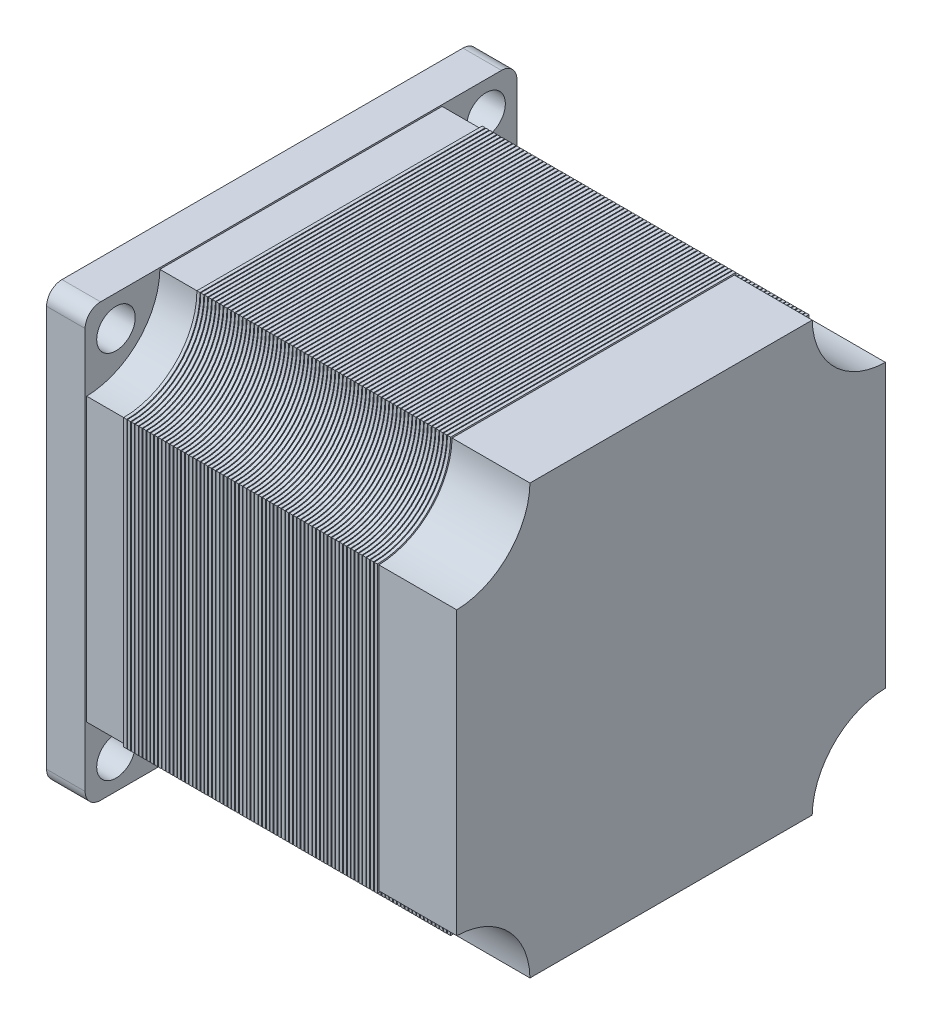
from build123d import *
from build123d.topology import SkipClean

# Parameters (mm, degrees)
SKETCH1_R           = 3
BOSS_EXTRUDE1_DEPTH = 33
CUT_EXTRUDE4_START  = -0.1
CUT_EXTRUDE4_DEPTH  = 0.1
LPATTERN5_COUNT     = 67
LPATTERN5_PITCH     = 0.5
BOSS_EXTRUDE4_DEPTH = 10
BOSS_EXTRUDE5_START = 5
BOSS_EXTRUDE5_DEPTH = 5
SKETCH14_R          = 2.5
BOSS_EXTRUDE7_DEPTH = 5
SKETCH15_R          = 20.5
BOSS_EXTRUDE8_DEPTH = 2
SKETCH16_R          = 3
CUT_EXTRUDE6_DEPTH  = 15


with BuildPart() as part:
    # Sketch1 → Boss-Extrude1 (new body)
    with BuildSketch(Plane(origin=(0, 0, 0), x_dir=(0, 0, -1), z_dir=(1, 0, 0))):
        with BuildLine():
            Line((-18.5, 28), (18.5, 28))
            ThreePointArc((18.5, 28), (21.282485579, 21.282485579), (28, 18.5))
            Line((28, 18.5), (28, -18.5))
            ThreePointArc((28, -18.5), (21.282485579, -21.282485579), (18.5, -28))
            Line((18.5, -28), (-18.5, -28))
            ThreePointArc((-18.5, -28), (-21.282485579, -21.282485579), (-28, -18.5))
            Line((-28, -18.5), (-28, 18.5))
            ThreePointArc((-28, 18.5), (-21.282485579, 21.282485579), (-18.5, 28))
        make_face()
        Circle(SKETCH1_R, mode=Mode.SUBTRACT)
    extrude(amount=BOSS_EXTRUDE1_DEPTH)

    # Sketch6 → Cut-Extrude4 (cut)
    with BuildSketch(Plane(origin=(33, 0, 0), x_dir=(0, 0, -1), z_dir=(1, 0, 0)).offset(CUT_EXTRUDE4_START)):
        with BuildLine():
            Line((28, -18.5), (28, 18.5))
            ThreePointArc((28, 18.5), (21.282485579, 21.282485579), (18.5, 28))
            Line((18.5, 28), (-18.5, 28))
            ThreePointArc((-18.5, 28), (-21.282485579, 21.282485579), (-28, 18.5))
            Line((-28, 18.5), (-28, -18.5))
            ThreePointArc((-28, -18.5), (-21.282485579, -21.282485579), (-18.5, -28))
            Line((-18.5, -28), (18.5, -28))
            ThreePointArc((18.5, -28), (21.282485579, -21.282485579), (28, -18.5))
        make_face()
        with BuildLine():
            Line((18.302062075, 27.8), (-18.302062075, 27.8))
            ThreePointArc((-18.302062075, 27.8), (-21.141064222, 21.141064222), (-27.8, 18.302062075))
            Line((-27.8, 18.302062075), (-27.8, -18.302062075))
            ThreePointArc((-27.8, -18.302062075), (-21.141064222, -21.141064222), (-18.302062075, -27.8))
            Line((-18.302062075, -27.8), (18.302062075, -27.8))
            ThreePointArc((18.302062075, -27.8), (21.141064222, -21.141064222), (27.8, -18.302062075))
            Line((27.8, -18.302062075), (27.8, 18.302062075))
            ThreePointArc((27.8, 18.302062075), (21.141064222, 21.141064222), (18.302062075, 27.8))
        make_face(mode=Mode.SUBTRACT)
    cut_extrude4 = extrude(amount=CUT_EXTRUDE4_DEPTH, mode=Mode.SUBTRACT)

    # LPattern5: Cut-Extrude4 ×67
    with Locations(*[(-i * LPATTERN5_PITCH, 0, 0) for i in range(1, LPATTERN5_COUNT)]):
        add(cut_extrude4, mode=Mode.SUBTRACT)

    # Sketch10 → Boss-Extrude4 (add)
    with BuildSketch(Plane(origin=(33, 0, 0), x_dir=(0, 0, -1), z_dir=(1, 0, 0))):
        with BuildLine():
            Line((27.8, -18.302062075), (27.8, 18.302062075))
            ThreePointArc((27.8, 18.302062075), (21.141064222, 21.141064222), (18.302062075, 27.8))
            Line((18.302062075, 27.8), (-18.302062075, 27.8))
            ThreePointArc((-18.302062075, 27.8), (-21.141064222, 21.141064222), (-27.8, 18.302062075))
            Line((-27.8, 18.302062075), (-27.8, -18.302062075))
            ThreePointArc((-27.8, -18.302062075), (-21.141064222, -21.141064222), (-18.302062075, -27.8))
            Line((-18.302062075, -27.8), (18.302062075, -27.8))
            ThreePointArc((18.302062075, -27.8), (21.141064222, -21.141064222), (27.8, -18.302062075))
        make_face()
    extrude(amount=BOSS_EXTRUDE4_DEPTH)

    # Sketch12 → Boss-Extrude5 (add)
    with BuildSketch(Plane.ZY.offset(BOSS_EXTRUDE5_START)):
        with BuildLine():
            Line((-27.8, 18.302062075), (-27.8, -18.302062075))
            ThreePointArc((-27.8, -18.302062075), (-21.141064222, -21.141064222), (-18.302062075, -27.8))
            Line((-18.302062075, -27.8), (18.302062075, -27.8))
            ThreePointArc((18.302062075, -27.8), (21.141064222, -21.141064222), (27.8, -18.302062075))
            Line((27.8, -18.302062075), (27.8, 18.302062075))
            ThreePointArc((27.8, 18.302062075), (21.141064222, 21.141064222), (18.302062075, 27.8))
            Line((18.302062075, 27.8), (-18.302062075, 27.8))
            ThreePointArc((-18.302062075, 27.8), (-21.141064222, 21.141064222), (-27.8, 18.302062075))
        make_face()
    extrude(amount=-BOSS_EXTRUDE5_DEPTH)

    # Sketch14 → Boss-Extrude7 (add)
    with BuildSketch(Plane.ZY.offset(5)):
        with BuildLine():
            Line((-26, 28), (26, 28))
            ThreePointArc((26, 28), (27.414213562, 27.414213562), (28, 26))
            Line((28, 26), (28, -26))
            ThreePointArc((28, -26), (27.414213562, -27.414213562), (26, -28))
            Line((26, -28), (-26, -28))
            ThreePointArc((-26, -28), (-27.414213562, -27.414213562), (-28, -26))
            Line((-28, -26), (-28, 26))
            ThreePointArc((-28, 26), (-27.414213562, 27.414213562), (-26, 28))
        make_face()
        with Locations((-24, 24)):
            Circle(SKETCH14_R, mode=Mode.SUBTRACT)
        with Locations((24, 24)):
            Circle(SKETCH14_R, mode=Mode.SUBTRACT)
        with Locations((24, -24)):
            Circle(SKETCH14_R, mode=Mode.SUBTRACT)
        with Locations((-24, -24)):
            Circle(SKETCH14_R, mode=Mode.SUBTRACT)
    extrude(amount=BOSS_EXTRUDE7_DEPTH)

    # Sketch15 → Boss-Extrude8 (add)
    with BuildSketch(Plane.ZY.offset(10)):
        Circle(SKETCH15_R)
    extrude(amount=BOSS_EXTRUDE8_DEPTH)

    # Sketch16 → Cut-Extrude6 (cut)
    with SkipClean():  # the faces are left unmerged after this step: merging them gives an invalid solid
        with BuildSketch(Plane.ZY.offset(12)):
            Circle(SKETCH16_R)
        extrude(amount=-CUT_EXTRUDE6_DEPTH, mode=Mode.SUBTRACT)


solid = part.part
